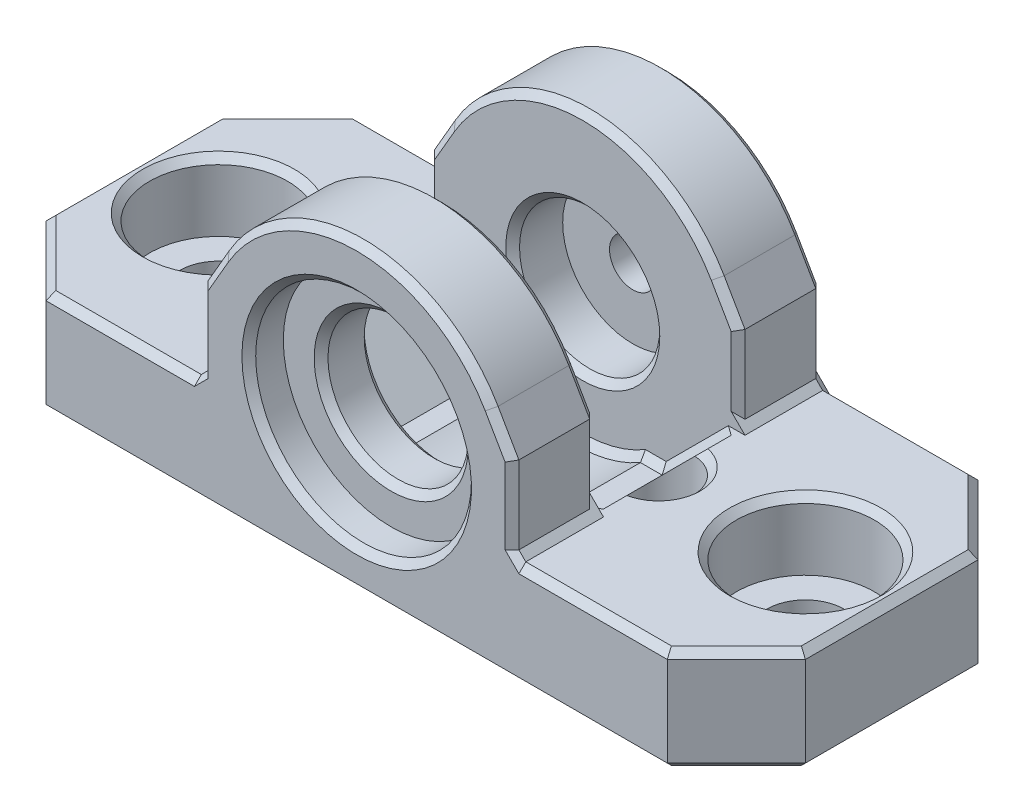
from build123d import *

# Parameters (mm, degrees)
SKETCH1_R                      = 4.0625
BOSS_EXTRUDE1_DEPTH            = 9
SKETCH1_2_R                    = 4.0625
CUT_EXTRUDE1_DEPTH             = 4.1
SKETCH2_W                      = 44
SKETCH2_H                      = 18
BOSS_EXTRUDE2_DEPTH            = 2
SKETCH3_W                      = 13
SKETCH3_H                      = 18
BOSS_EXTRUDE3_DEPTH            = 4
CBORE_FOR_M4_SHCS1_D           = 4.5
CBORE_FOR_M4_SHCS1_CBORE_D     = 8
CBORE_FOR_M4_SHCS1_CBORE_DEPTH = 4
BOSS_EXTRUDE6_REACH            = 38.635
CHAMFER2_SIZE                  = 4
F_6_0MM_DOWEL_HOLE1_D          = 4
CUT_EXTRUDE2_REACH             = 37.377
SKETCH13_R                     = 7.5
CUT_EXTRUDE2_DIRECTION_2_REACH = 37.377
SKETCH19_R                     = 6.25
CUT_EXTRUDE3_DEPTH             = 2
SKETCH20_R                     = 4.0625
SKETCH20_R_2                   = 1.35
BOSS_EXTRUDE5_DEPTH            = 2
CHAMFER8_SIZE                  = 0.4
CHAMFER11_SIZE                 = 0.4
CHAMFER12_SIZE                 = 0.4
CHAMFER14_SIZE                 = 0.4
CHAMFER15_SIZE                 = 0.4


with BuildPart() as part:
    # Sketch1 → Boss-Extrude1 (new, symmetric)
    with BuildSketch(Plane.XY):
        with BuildLine():
            Line((-16.294228634, 11), (-17.5, 8.911542732))
            Line((-17.5, 8.911542732), (-17.5, 0))
            Line((-17.5, 0), (0.5, 0))
            Line((0.5, 0), (0.5, 8.911542732))
            Line((0.5, 8.911542732), (-0.705771366, 11))
            ThreePointArc((-0.705771366, 11), (-8.5, 15.5), (-16.294228634, 11))
        make_face()
        with Locations((-8.5, 6.5)):
            Circle(SKETCH1_R, mode=Mode.SUBTRACT)
    extrude(amount=BOSS_EXTRUDE1_DEPTH, both=True)

    # Sketch1<2> → Cut-Extrude1 (cut, symmetric)
    with BuildSketch(Plane.XY):
        with BuildLine():
            Line((-16.294228634, 11), (-17.5, 8.911542732))
            Line((-17.5, 8.911542732), (-17.5, 0))
            Line((-17.5, 0), (0.5, 0))
            Line((0.5, 0), (0.5, 8.911542732))
            Line((0.5, 8.911542732), (-0.705771366, 11))
            ThreePointArc((-0.705771366, 11), (-8.5, 15.5), (-16.294228634, 11))
        make_face()
        with Locations((-8.5, 6.5)):
            Circle(SKETCH1_2_R, mode=Mode.SUBTRACT)
    extrude(amount=CUT_EXTRUDE1_DEPTH, both=True, mode=Mode.SUBTRACT)


with BuildPart() as cut_extrude1_piece_1:
    # of the separate pieces the step leaves, piece 1, a body of its own (cut_extrude1_pieces)
    add(part.part.solids().sort_by_distance((-0.705771366, 11, -4.1))[0])



with BuildPart() as cut_extrude1_piece_2:
    # of the separate pieces the step leaves, piece 2, a body of its own (cut_extrude1_pieces)
    add(part.part.solids().sort_by_distance((-0.705771366, 11, 9))[0])


with BuildPart() as cut_extrude1_piece_1_1:
    add(cut_extrude1_piece_1.part)

    add(cut_extrude1_piece_2.part)  # Boss-Extrude2 merges Cut-Extrude1 piece 2
    # Sketch2 → Boss-Extrude2 (add)
    with BuildSketch(Plane.XZ):
        with Locations((-8.5, 0)):
            Rectangle(SKETCH2_W, SKETCH2_H)
    extrude(amount=BOSS_EXTRUDE2_DEPTH)

    # Sketch3 → Boss-Extrude3 (add)
    with BuildSketch(Plane(origin=(0, 0, 0), x_dir=(1, 0, 0), z_dir=(0, 1, 0))):
        with Locations((-24, 0)):
            Rectangle(SKETCH3_W, SKETCH3_H)
    boss_extrude3 = extrude(amount=BOSS_EXTRUDE3_DEPTH)

    # Mirror1: Boss-Extrude3 across plane
    add(boss_extrude3.mirror(Plane(origin=(-8.5, 0, 0), x_dir=(0, 0, 1), z_dir=(1, 0, 0))))

    # CBORE for M4 SHCS1 (through all)
    with Locations(Plane(origin=(0, 4, 0), x_dir=(1, 0, 0), z_dir=(0, 1, 0))):
        with Locations((-25.5, 0), (8.5, 0)):
            CounterBoreHole(CBORE_FOR_M4_SHCS1_D / 2, CBORE_FOR_M4_SHCS1_CBORE_D / 2, CBORE_FOR_M4_SHCS1_CBORE_DEPTH)

    # Sketch21 → Boss-Extrude6 (add, up to next)
    with BuildSketch(Plane.XY.offset(-4.1), mode=Mode.PRIVATE) as boss_extrude6_sk1:
        Polygon((-17.5, 4), (-13.5, 0), (-17.5, 0), align=None)
    boss_extrude6_tool1 = extrude(boss_extrude6_sk1.sketch, amount=BOSS_EXTRUDE6_REACH, mode=Mode.PRIVATE) - cut_extrude1_piece_1_1.part
    # Sketch21 → Boss-Extrude6 (add, up to next)
    with BuildSketch(Plane.XY.offset(-4.1), mode=Mode.PRIVATE) as boss_extrude6_sk2:
        Polygon((0.5, 4), (0.5, 0), (-3.5, 0), align=None)
    boss_extrude6_tool2 = extrude(boss_extrude6_sk2.sketch, amount=BOSS_EXTRUDE6_REACH, mode=Mode.PRIVATE) - cut_extrude1_piece_1_1.part
    add(boss_extrude6_tool1.solids().sort_by_distance((-16.166667, 1.333333, -4.1))[0])
    add(boss_extrude6_tool2.solids().sort_by_distance((-0.833333, 1.333333, -4.1))[0])

    # Chamfer2
    chamfer2_edges = [cut_extrude1_piece_1_1.edges().sort_by_distance(p)[0] for p in [
        (-30.5, 1, -9),
        (-30.5, 1, 9),
        (13.5, 1, -9),
        (13.5, 1, 9),
    ]]
    chamfer(chamfer2_edges, length=CHAMFER2_SIZE)

    # Ø6.0mm Dowel Hole1 (through all)
    with Locations(Plane(origin=(0, 4, 0), x_dir=(1, 0, 0), z_dir=(0, 1, 0))):
        with Locations((0, 0)):
            Hole(F_6_0MM_DOWEL_HOLE1_D / 2)

    # Cut-Extrude2: up to this face of the body (flat: up to its plane)
    cut_extrude2_end = Plane(cut_extrude1_piece_1_1.part.faces().sort_by_distance((-0.308600899, 9.837001631, -4.1))[0])
    # Sketch13 → Cut-Extrude2 (cut, up to the picked face)
    with BuildSketch(Plane.XY, mode=Mode.PRIVATE) as cut_extrude2_sk1:
        with Locations((-8.5, 6.5)):
            Circle(SKETCH13_R)
    cut_extrude2_tool1 = split(extrude(cut_extrude2_sk1.sketch, amount=-CUT_EXTRUDE2_REACH, mode=Mode.PRIVATE), bisect_by=cut_extrude2_end, keep=Keep.BOTH, mode=Mode.PRIVATE)
    add(cut_extrude2_tool1.solids().sort_by(Axis((-8.5, 6.5, 0), (0, 0, -1)))[0], mode=Mode.SUBTRACT)

    # Cut-Extrude2 direction 2: up to this face of the body (flat: up to its plane)
    cut_extrude2_direction_2_end = Plane(cut_extrude1_piece_1_1.part.faces().sort_by_distance((-0.308600899, 9.837001631, 4.1))[0])
    # Sketch13 → Cut-Extrude2 direction 2 (cut, up to the picked face)
    with BuildSketch(Plane.XY, mode=Mode.PRIVATE) as cut_extrude2_direction_2_sk1:
        with Locations((-8.5, 6.5)):
            Circle(SKETCH13_R)
    cut_extrude2_direction_2_tool1 = split(extrude(cut_extrude2_direction_2_sk1.sketch, amount=CUT_EXTRUDE2_DIRECTION_2_REACH, mode=Mode.PRIVATE), bisect_by=cut_extrude2_direction_2_end, keep=Keep.BOTH, mode=Mode.PRIVATE)
    add(cut_extrude2_direction_2_tool1.solids().sort_by(Axis((-8.5, 6.5, 0), (0, 0, 1)))[0], mode=Mode.SUBTRACT)

    # Sketch19 → Cut-Extrude3 (cut)
    with BuildSketch(Plane.XY.offset(9)):
        with Locations((-8.5, 6.5)):
            Circle(SKETCH19_R)
    extrude(amount=-CUT_EXTRUDE3_DEPTH, mode=Mode.SUBTRACT)

    # Sketch20 → Boss-Extrude5 (add)
    with BuildSketch(Plane(origin=(0, 0, -9), x_dir=(-1, 0, 0), z_dir=(0, 0, -1))):
        with Locations((8.5, 6.5)):
            Circle(SKETCH20_R)
        with Locations((8.5, 6.5)):
            Circle(SKETCH20_R_2, mode=Mode.SUBTRACT)
    extrude(amount=-BOSS_EXTRUDE5_DEPTH)

    # Chamfer8
    chamfer8_edges = [cut_extrude1_piece_1_1.edges().sort_by_distance(p)[0] for p in [
        (4.5, 4, 0),
        (2, 4, 0),
        (-22, 4, -9),
        (-28.5, 4, -7),
        (-30.5, 4, 0),
        (-28.5, 4, 7),
        (-22, 4, 9),
        (-17.5, 4, -6.55),
        (-17.5, 4, 6.55),
        (-17.5, 6.455771366, 9),
        (-16.897114317, 9.955771366, 9),
        (-8.5, 15.5, 9),
        (-0.102885683, 9.955771366, 9),
        (0.5, 6.455771366, 9),
        (-17.5, 6.455771366, -9),
        (-16.897114317, 9.955771366, -9),
        (-8.5, 15.5, -9),
        (-0.102885683, 9.955771366, -9),
        (0.5, 6.455771366, -9),
        (0.5, 4, -6.55),
        (5, 4, -9),
        (11.5, 4, -7),
        (13.5, 4, 0),
        (11.5, 4, 7),
        (0.5, 4, 6.55),
        (5, 4, 9),
        (-29.5, 4, 0),
    ]]
    chamfer(chamfer8_edges, length=CHAMFER8_SIZE)

    # Chamfer11
    chamfer11_edges = [cut_extrude1_piece_1_1.edges().sort_by_distance(p)[0] for p in [
        (-12.5625, 6.5, 7),
        (-12.5625, 6.5, 4.1),
        (-14.75, 6.5, 9),
        (-12.5625, 6.5, -4.1),
    ]]
    chamfer(chamfer11_edges, length=CHAMFER11_SIZE)

    # Chamfer12
    chamfer12_edges = [cut_extrude1_piece_1_1.edges().sort_by_distance(p)[0] for p in [
        (-28.5, -2, -7),
        (-30.5, -2, 0),
        (-28.5, -2, 7),
        (-8.5, -2, 9),
        (11.5, -2, 7),
        (13.5, -2, 0),
        (11.5, -2, -7),
        (-8.5, -2, -9),
        (10.75, -2, 0),
        (-23.25, -2, 0),
        (2, -2, 0),
    ]]
    chamfer(chamfer12_edges, length=CHAMFER12_SIZE)

    # Chamfer14
    chamfer14_edges = [cut_extrude1_piece_1_1.edges().sort_by_distance(p)[0] for p in [
        (0.5, 6.655771366, 4.1),
        (-0.102885683, 9.955771366, 4.1),
        (-8.5, 15.5, 4.1),
        (-16.897114317, 9.955771366, 4.1),
        (-17.5, 6.655771366, 4.1),
        (0.5, 6.655771366, -4.1),
        (-17.5, 6.655771366, -4.1),
        (-0.102885683, 9.955771366, -4.1),
        (-8.5, 15.5, -4.1),
        (-16.897114317, 9.955771366, -4.1),
    ]]
    chamfer(chamfer14_edges, length=CHAMFER14_SIZE)

    # Chamfer15
    chamfer15_edges = [cut_extrude1_piece_1_1.edges().sort_by_distance(p)[0] for p in [
        (-1.5, 2, -4.1),
        (-4.129171307, 0, -4.1),
        (-8.5, -1, -4.1),
        (-12.870828693, 0, -4.1),
        (-15.5, 2, -4.1),
        (-1.5, 2, 4.1),
        (-4.129171307, 0, 4.1),
        (-8.5, -1, 4.1),
        (-12.870828693, 0, 4.1),
        (-15.5, 2, 4.1),
    ]]
    chamfer(chamfer15_edges, length=CHAMFER15_SIZE)


solid = cut_extrude1_piece_1_1.part
